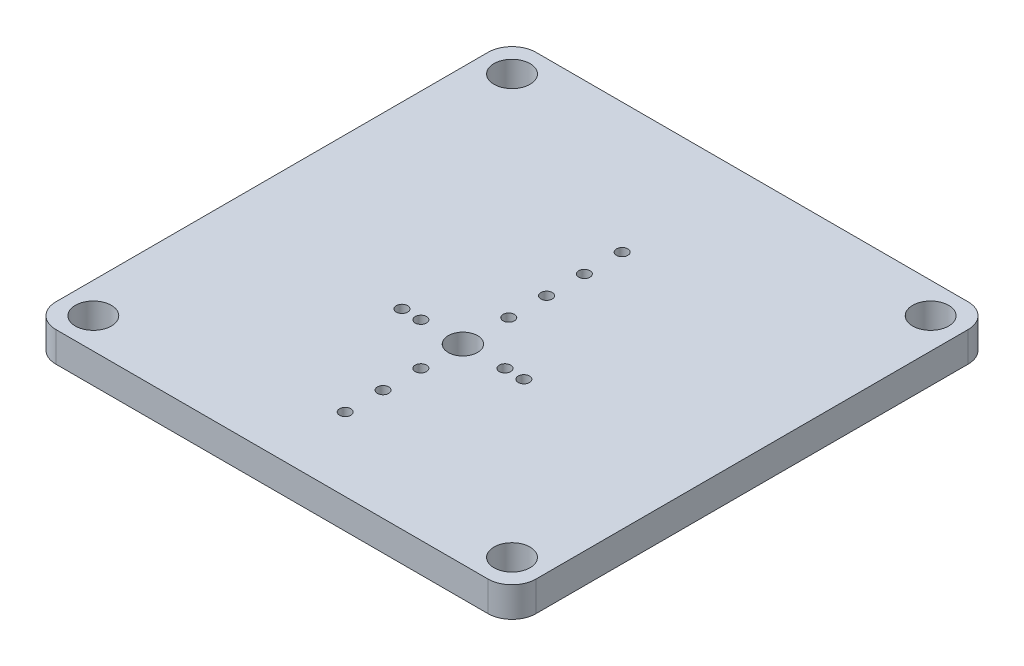
from build123d import *

# Parameters (mm, degrees)
SKETCH1_W           = 50.8
SKETCH1_H           = 50.8
SKETCH1_R           = 1.905
SKETCH1_R_2         = 0.6
SKETCH1_R_3         = 1.55
BOSS_EXTRUDE1_DEPTH = 3.175
FILLET1_R           = 2.54


with BuildPart() as part:
    # Sketch1 → Boss-Extrude1 (new body)
    with BuildSketch(Plane(origin=(0, 0, 0), x_dir=(1, 0, 0), z_dir=(0, 1, 0))):
        with Locations((25.4, 25.4)):
            Rectangle(SKETCH1_W, SKETCH1_H)
        with Locations((3.251252547, 3.251252547)):
            Circle(SKETCH1_R, mode=Mode.SUBTRACT)
        with Locations((18.954, 20.202)):
            Circle(SKETCH1_R_2, mode=Mode.SUBTRACT)
        with Locations((20.954, 20.202)):
            Circle(SKETCH1_R_2, mode=Mode.SUBTRACT)
        with Locations((25.404, 7.752)):
            Circle(SKETCH1_R_2, mode=Mode.SUBTRACT)
        with Locations((25.404, 11.752)):
            Circle(SKETCH1_R_2, mode=Mode.SUBTRACT)
        with Locations((47.548747453, 3.251252547)):
            Circle(SKETCH1_R, mode=Mode.SUBTRACT)
        with Locations((25.404, 15.752)):
            Circle(SKETCH1_R_2, mode=Mode.SUBTRACT)
        with Locations((25.404, 20.202)):
            Circle(SKETCH1_R_3, mode=Mode.SUBTRACT)
        with Locations((29.854, 20.202)):
            Circle(SKETCH1_R_2, mode=Mode.SUBTRACT)
        with Locations((25.404, 25.052)):
            Circle(SKETCH1_R_2, mode=Mode.SUBTRACT)
        with Locations((31.854, 20.202)):
            Circle(SKETCH1_R_2, mode=Mode.SUBTRACT)
        with BuildLine():
            ThreePointArc((5.156252547, 47.548747453), (2.522240608, 45.788756944), (1.904214129, 48.895785871))
            ThreePointArc((1.904214129, 48.895785871), (3.980264486, 49.308737963), (5.156252547, 47.548747453))
        make_face(mode=Mode.SUBTRACT)
        with Locations((25.404, 29.052)):
            Circle(SKETCH1_R_2, mode=Mode.SUBTRACT)
        with Locations((25.404, 33.052)):
            Circle(SKETCH1_R_2, mode=Mode.SUBTRACT)
        with Locations((25.404, 37.052)):
            Circle(SKETCH1_R_2, mode=Mode.SUBTRACT)
        with Locations((47.548747453, 47.548747453)):
            Circle(SKETCH1_R, mode=Mode.SUBTRACT)
    extrude(amount=BOSS_EXTRUDE1_DEPTH)

    # Fillet1
    fillet1_edges = [part.edges().sort_by_distance(p)[0] for p in [
        (50.8, 1.5875, -50.8),
        (50.8, 1.5875, 0),
        (0, 1.5875, 0),
        (0, 1.5875, -50.8),
    ]]
    fillet(fillet1_edges, radius=FILLET1_R)


solid = part.part
